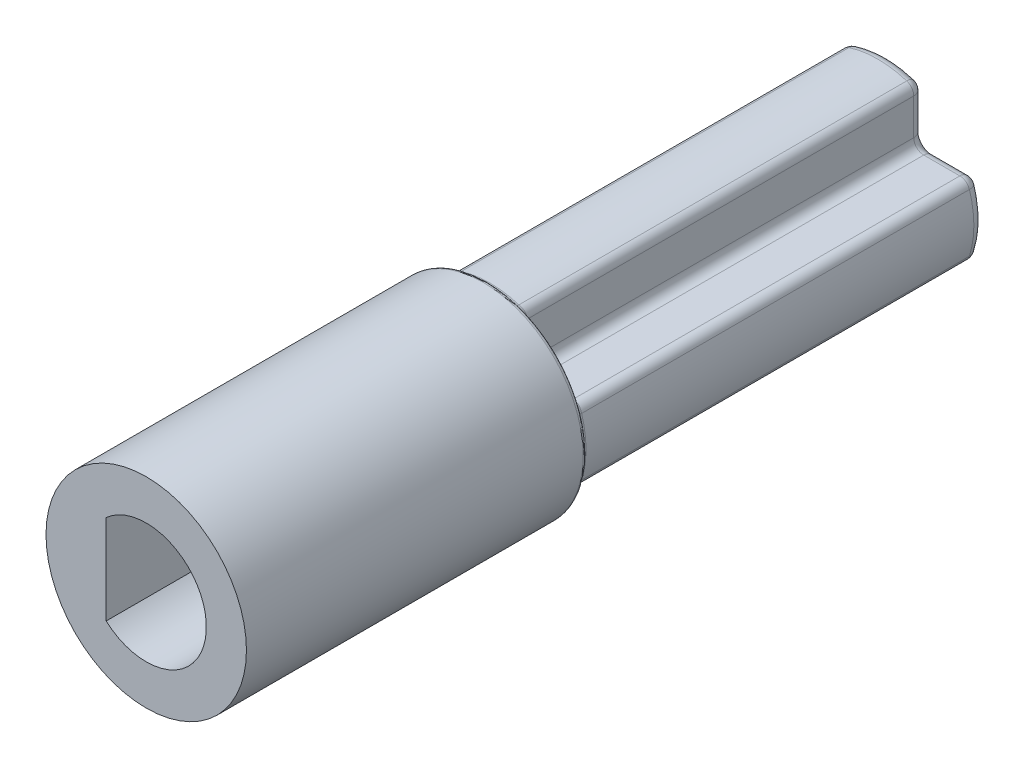
from build123d import *

# Parameters (mm, degrees)
SKETCH2_R           = 2.5
BOSS_EXTRUDE1_DEPTH = 6.5
BOSS_EXTRUDE2_START = 2
SKETCH3_R           = 2.5
BOSS_EXTRUDE2_DEPTH = 2
BOSS_EXTRUDE3_DEPTH = 10
FILLET1_R           = 0.25
FILLET2_R           = 0.1
FILLET3_R           = 0.1
SKETCH5_R           = 0.25
CUT_EXTRUDE1_DEPTH  = 19.834808228


with BuildPart() as part:
    # Sketch2 → Boss-Extrude1 (new body)
    with BuildSketch(Plane.XY):
        Circle(SKETCH2_R)
        with BuildLine():
            Line((-1, 1.118033989), (-1, -1.118033989))
            ThreePointArc((-1, -1.118033989), (1.5, 0), (-1, 1.118033989))
        make_face(mode=Mode.SUBTRACT)
    extrude(amount=BOSS_EXTRUDE1_DEPTH)

    # Sketch3 → Boss-Extrude2 (add)
    with BuildSketch(Plane(origin=(0, 0, 0), x_dir=(-1, 0, 0), z_dir=(0, 0, -1)).offset(BOSS_EXTRUDE2_START)):
        Circle(SKETCH3_R)
    extrude(amount=-BOSS_EXTRUDE2_DEPTH)

    # Sketch4 → Boss-Extrude3 (add)
    with BuildSketch(Plane(origin=(0, 0, -2), x_dir=(-1, 0, 0), z_dir=(0, 0, -1))):
        with BuildLine():
            Line((-2.045727255, 0.895), (-1.145, 0.895))
            ThreePointArc((-1.145, 0.895), (-0.968223305, 0.968223305), (-0.895, 1.145))
            Line((-0.895, 1.145), (-0.895, 2.045727255))
            ThreePointArc((-0.895, 2.045727255), (-0.846610647, 2.193555354), (-0.720174825, 2.284157004))
            ThreePointArc((-0.720174825, 2.284157004), (0, 2.395), (0.720174825, 2.284157004))
            ThreePointArc((0.720174825, 2.284157004), (0.846610647, 2.193555354), (0.895, 2.045727255))
            Line((0.895, 2.045727255), (0.895, 1.145))
            ThreePointArc((0.895, 1.145), (0.968223305, 0.968223305), (1.145, 0.895))
            Line((1.145, 0.895), (2.045727255, 0.895))
            ThreePointArc((2.045727255, 0.895), (2.193555354, 0.846610647), (2.284157004, 0.720174825))
            ThreePointArc((2.284157004, 0.720174825), (2.395, 0), (2.284157004, -0.720174825))
            ThreePointArc((2.284157004, -0.720174825), (2.193555354, -0.846610647), (2.045727255, -0.895))
            Line((2.045727255, -0.895), (1.145, -0.895))
            ThreePointArc((1.145, -0.895), (0.968223305, -0.968223305), (0.895, -1.145))
            Line((0.895, -1.145), (0.895, -2.045727255))
            ThreePointArc((0.895, -2.045727255), (0.846610647, -2.193555354), (0.720174825, -2.284157004))
            ThreePointArc((0.720174825, -2.284157004), (0, -2.395), (-0.720174825, -2.284157004))
            ThreePointArc((-0.720174825, -2.284157004), (-0.846610647, -2.193555354), (-0.895, -2.045727255))
            Line((-0.895, -2.045727255), (-0.895, -1.145))
            ThreePointArc((-0.895, -1.145), (-0.968223305, -0.968223305), (-1.145, -0.895))
            Line((-1.145, -0.895), (-2.045727255, -0.895))
            ThreePointArc((-2.045727255, -0.895), (-2.193555354, -0.846610647), (-2.284157004, -0.720174825))
            ThreePointArc((-2.284157004, -0.720174825), (-2.395, 0), (-2.284157004, 0.720174825))
            ThreePointArc((-2.284157004, 0.720174825), (-2.193555354, 0.846610647), (-2.045727255, 0.895))
        make_face()
    extrude(amount=BOSS_EXTRUDE3_DEPTH)

    # Fillet1
    fillet1_edges = [part.edges().sort_by_distance(p)[0] for p in [
        (2.193555354, 0.846610647, -12),
        (2.395, 0, -12),
        (2.193555354, -0.846610647, -12),
        (1.595363627, -0.895, -12),
        (0.968223305, -0.968223305, -12),
        (0.895, -1.595363627, -12),
        (0.846610647, -2.193555354, -12),
        (0, -2.395, -12),
        (-0.846610647, -2.193555354, -12),
        (-0.895, -1.595363627, -12),
        (-0.968223305, -0.968223305, -12),
        (-1.595363627, -0.895, -12),
        (-2.193555354, -0.846610647, -12),
        (-2.395, 0, -12),
        (-2.193555354, 0.846610647, -12),
        (-1.595363627, 0.895, -12),
        (-0.968223305, 0.968223305, -12),
        (-0.895, 1.595363627, -12),
        (-0.846610647, 2.193555354, -12),
        (0, 2.395, -12),
        (0.846610647, 2.193555354, -12),
        (0.895, 1.595363627, -12),
        (0.968223305, 0.968223305, -12),
        (1.595363627, 0.895, -12),
    ]]
    fillet(fillet1_edges, radius=FILLET1_R)

    # Fillet2
    fillet2_edges = [part.edges().sort_by_distance(p)[0] for p in [
        (2.5, 0, -2),
    ]]
    fillet(fillet2_edges, radius=FILLET2_R)

    # Fillet3
    fillet3_edges = [part.edges().sort_by_distance(p)[0] for p in [
        (-0.895, -1.595363627, -2),
        (-0.846610647, -2.193555354, -2),
        (0, -2.395, -2),
        (0.846610647, -2.193555354, -2),
        (0.895, -1.595363627, -2),
        (0.968223305, -0.968223305, -2),
        (1.595363627, -0.895, -2),
        (2.193555354, -0.846610647, -2),
        (2.395, 0, -2),
        (2.193555354, 0.846610647, -2),
        (1.595363627, 0.895, -2),
        (0.968223305, 0.968223305, -2),
        (0.895, 1.595363627, -2),
        (0.846610647, 2.193555354, -2),
        (0, 2.395, -2),
        (-0.846610647, 2.193555354, -2),
        (-0.895, 1.595363627, -2),
        (-0.968223305, 0.968223305, -2),
        (-1.595363627, 0.895, -2),
        (-2.193555354, 0.846610647, -2),
        (-2.395, 0, -2),
        (-2.193555354, -0.846610647, -2),
        (-1.595363627, -0.895, -2),
        (-0.968223305, -0.968223305, -2),
    ]]
    fillet(fillet3_edges, radius=FILLET3_R)

    # Sketch5 → Cut-Extrude1 (cut, through all)
    with BuildSketch(Plane(origin=(0, 0, -12), x_dir=(-1, 0, 0), z_dir=(0, 0, -1))):
        Circle(SKETCH5_R)
    extrude(amount=-CUT_EXTRUDE1_DEPTH, mode=Mode.SUBTRACT)


solid = part.part
